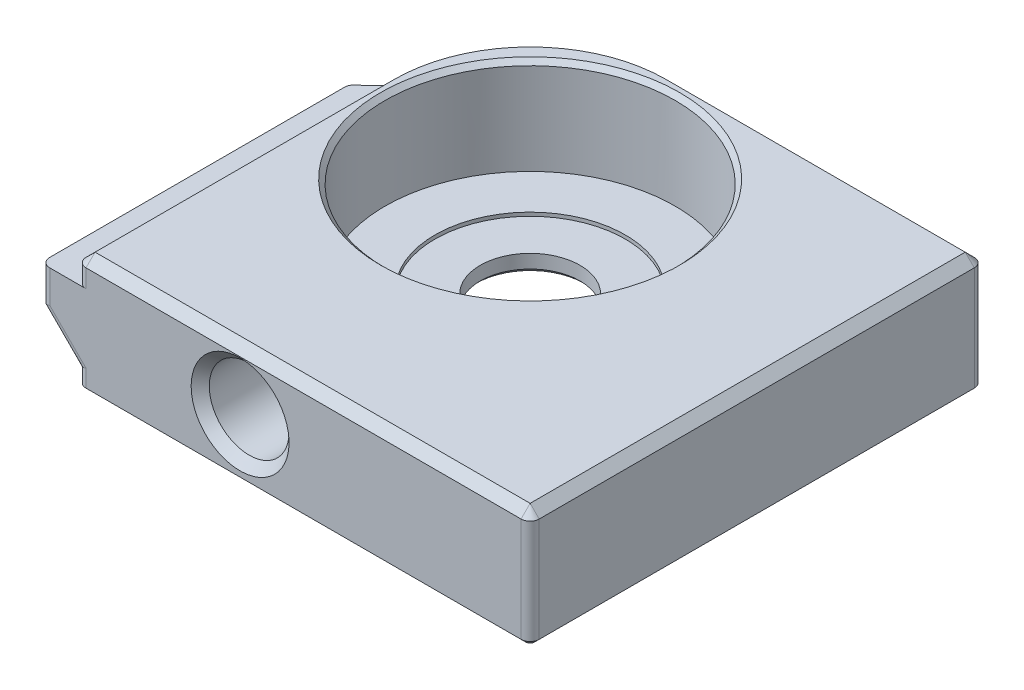
from build123d import *

# Parameters (mm, degrees)
SKETCH1_W           = 25
SKETCH1_H           = 25
BOSS_EXTRUDE1_DEPTH = 6.5
SKETCH2_R           = 8
CUT_EXTRUDE1_DEPTH  = 5.5
FILLET1_R           = 8
SKETCH4_R           = 2.2
CUT_EXTRUDE2_DEPTH  = 7.5
BOSS_EXTRUDE2_DEPTH = 17
FILLET2_R           = 10
SKETCH6_R           = 2.75
CUT_EXTRUDE3_DEPTH  = 20.918584287
BOSS_EXTRUDE3_START = 0.2
SKETCH7_R           = 8
SKETCH7_R_2         = 5.25
BOSS_EXTRUDE3_DEPTH = 0.2
FILLET3_R           = 0.5
CHAMFER1_SIZE       = 0.5
CHAMFER7_SIZE       = 0.25


# Some blends are built 0.0001 mm under size
with BuildPart() as part:
    # Sketch1 → Boss-Extrude1 (new body)
    with BuildSketch(Plane(origin=(0, 0, 0), x_dir=(1, 0, 0), z_dir=(0, 1, 0))):
        Rectangle(SKETCH1_W, SKETCH1_H)
    extrude(amount=BOSS_EXTRUDE1_DEPTH)

    # Sketch2 → Cut-Extrude1 (cut)
    with BuildSketch(Plane(origin=(0, 6.5, 0), x_dir=(1, 0, 0), z_dir=(0, 1, 0))):
        with Locations(Location((-3.5, 3.5, 0), (0, 0, 270))):
            Circle(SKETCH2_R)
    extrude(amount=-CUT_EXTRUDE1_DEPTH, mode=Mode.SUBTRACT)

    # Fillet1
    fillet1_edges = [part.edges().sort_by_distance(p)[0] for p in [
        (-12.5, 3.25, -12.5),
    ]]
    fillet(fillet1_edges, radius=FILLET1_R)

    # Sketch4 → Cut-Extrude2 (cut)
    with BuildSketch(Plane.XY.offset(12.5)):
        with Locations((-3.5, 3.25)):
            Circle(SKETCH4_R)
    extrude(amount=-CUT_EXTRUDE2_DEPTH, mode=Mode.SUBTRACT)

    # Sketch5 → Boss-Extrude2 (add)
    with BuildSketch(Plane.XY.offset(12.5)):
        Polygon((-12.5, 1), (-14.5, 3), (-14.5, 5), (-12.5, 5), align=None)
    extrude(amount=-BOSS_EXTRUDE2_DEPTH)

    # Fillet2
    # the kernel refuses this fillet: 10 mm, written as the material it adds along each edge
    with BuildSketch(Plane(origin=(-12.5, 5, -4.5), x_dir=(0.22360679774997813, 0, -0.9746794344808967), z_dir=(0, -1, 0))) as fillet2_piece_1_section:
        with BuildLine():
            CenterArc((5.813776741, -9.746794345), FILLET2_R, 102.920966382, 25.841932763)
            Line((-0.447213595, -1.949358869), (-0.572433402, -1.793410159))
            ThreePointArc((-0.572433402, -1.793410159), (-0.418542685, -0.929958075), (-0.194935887, 0.04472136))
            Line((-0.194935887, 0.04472136), (0.04472136, 0.194935887))
            ThreePointArc((0.04472136, 0.194935887), (1.788854382, -0.002564524), (3.532987404, 0.194935887))
            Line((3.532987404, 0.194935887), (3.577708764, 0))
        make_face()
    fillet2_piece_1 = extrude(amount=12.94427191, mode=Mode.PRIVATE)
    fillet2_piece_1 = split(fillet2_piece_1, bisect_by=Plane(origin=(-14.5, 3, -4.5), z_dir=(0.7071067811865512, 0.7071067811865438, 0)), keep=Keep.TOP, mode=Mode.PRIVATE)
    add(fillet2_piece_1)

    # Sketch6 → Cut-Extrude3 (cut, through all)
    with BuildSketch(Plane(origin=(0, 1, 0), x_dir=(1, 0, 0), z_dir=(0, 1, 0))):
        with Locations(Location((-3.5, 3.5, 0), (0, 0, 270))):
            Circle(SKETCH6_R)
    extrude(amount=-CUT_EXTRUDE3_DEPTH, mode=Mode.SUBTRACT)

    # Sketch7 → Boss-Extrude3 (add)
    with BuildSketch(Plane(origin=(0, 1, 0), x_dir=(1, 0, 0), z_dir=(0, 1, 0)).offset(BOSS_EXTRUDE3_START)):
        with Locations(Location((-3.5, 3.5, 0), (0, 0, 270))):
            Circle(SKETCH7_R)
        with Locations(Location((-3.5, 3.5, 0), (0, 0, 270))):
            Circle(SKETCH7_R_2, mode=Mode.SUBTRACT)
    extrude(amount=-BOSS_EXTRUDE3_DEPTH)

    # Fillet3
    fillet3_edges = [part.edges().sort_by_distance(p)[0] for p in [
        (-14.5, 4, -4.5),
        (-12.5, 0.5, 12.5),
        (-13.5, 2, 12.5),
        (-14.5, 4, 12.5),
        (-12.5, 5.75, 12.5),
        (12.5, 3.25, -12.5),
        (12.5, 3.25, 12.5),
    ]]
    fillet(fillet3_edges, radius=FILLET3_R)

    # Chamfer1
    chamfer1_edges = [part.edges().sort_by_distance(p)[0] for p in [
        (0, 6.5, 12.5),
        (3.75, 6.5, -12.5),
        (12.5, 6.5, 0),
        (12.353553391, 6.5, 12.353553391),
        (12.353553391, 6.5, -12.353553391),
        (-12.353553391, 6.5, 12.353553391),
        (-12.5, 6.5, 3.75),
        (-10.156854249, 6.5, -10.156854249),
        (-5.7, 3.25, 12.5),
    ]]
    chamfer(chamfer1_edges, length=CHAMFER1_SIZE - 0.0001)  # a hair under: the kernel refuses the full size

    # Chamfer7
    # the kernel refuses this chamfer: 0.25 mm, written as the material it takes off along each edge
    with BuildSketch(Plane(origin=(-3.5, 0, -3.5), x_dir=(0, 0, 1), z_dir=(-1, 0, 0))) as chamfer7_piece_1:
        Polygon((2.75 + CHAMFER7_SIZE, 0), (2.75, CHAMFER7_SIZE), (2.75, 0), align=None)
    revolve(axis=Axis((-3.5, 0, -3.5), (0, 1, 0)), mode=Mode.SUBTRACT)
    with BuildSketch(Plane(origin=(-12.5, 0, -7.714603735), x_dir=(1, 0, 0), z_dir=(0, 0, 1)), Plane(origin=(12, 0, -12.5), x_dir=(0, 0, 1), z_dir=(-1, 0, 0))) as chamfer7_piece_2:
        Polygon((CHAMFER7_SIZE, 0), (0, CHAMFER7_SIZE), (0, 0), align=None)
    extrude(amount=19.714603735, mode=Mode.SUBTRACT)
    with BuildSketch(Plane(origin=(-12, 0, 12.5), x_dir=(0, 1, 0), z_dir=(1, 0, 0))) as chamfer7_piece_3:
        Polygon((CHAMFER7_SIZE, 0), (0, -CHAMFER7_SIZE), (0, 0), align=None)
    extrude(amount=24, mode=Mode.SUBTRACT)
    with BuildSketch(Plane(origin=(12.5, 0, 12), x_dir=(-1, 0, 0), z_dir=(0, 0, -1))) as chamfer7_piece_4:
        Polygon((CHAMFER7_SIZE, 0), (0, CHAMFER7_SIZE), (0, 0), align=None)
    extrude(amount=24, mode=Mode.SUBTRACT)
    with BuildSketch(Plane(origin=(-3.5, 6.5, -3.5), x_dir=(0, 0, 1), z_dir=(-1, 0, 0))) as chamfer7_piece_5:
        Polygon((8 + CHAMFER7_SIZE, 0), (8, -CHAMFER7_SIZE), (8, 0), align=None)
    revolve(axis=Axis((-3.5, 6.5, -3.5), (0, 1, 0)), mode=Mode.SUBTRACT)
    with BuildSketch(Plane(origin=(12, 0, -12), x_dir=(0, 0, -1), z_dir=(-1, 0, 0))) as chamfer7_piece_6:
        Polygon((0.5 - CHAMFER7_SIZE, 0), (0.5, -CHAMFER7_SIZE), (0.5, 0), align=None)
    revolve(axis=Axis((12, 0, -12), (0, -1, 0)), revolution_arc=90, mode=Mode.SUBTRACT)
    with BuildSketch(Plane(origin=(12, 0, 12), x_dir=(0, 0, 1), z_dir=(-1, 0, 0))) as chamfer7_piece_7:
        Polygon((0.5, CHAMFER7_SIZE), (0.5 - CHAMFER7_SIZE, 0), (0.5, 0), align=None)
    revolve(axis=Axis((12, 0, 12), (0, 1, 0)), revolution_arc=90, mode=Mode.SUBTRACT)
    with BuildSketch(Plane(origin=(-12, 0, 12), x_dir=(0, 0, 1), z_dir=(1, 0, 0))) as chamfer7_piece_8:
        Polygon((0.5 - CHAMFER7_SIZE, 0), (0.5, -CHAMFER7_SIZE), (0.5, 0), align=None)
    revolve(axis=Axis((-12, 0, 12), (0, -1, 0)), revolution_arc=90, mode=Mode.SUBTRACT)


solid = part.part
